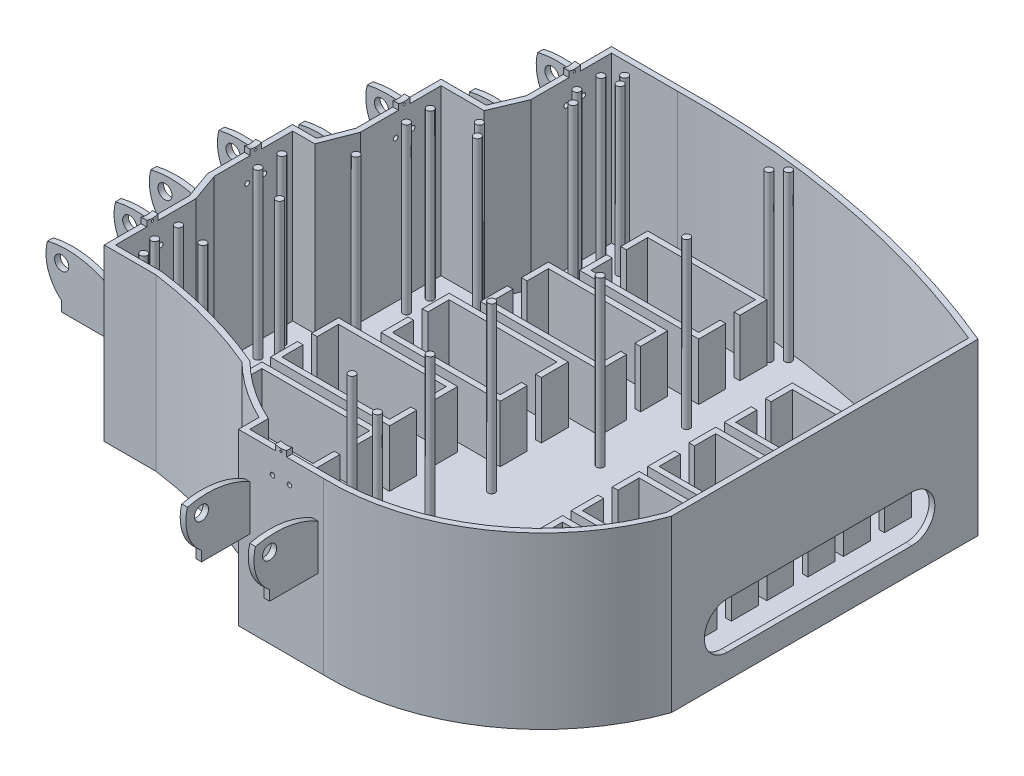
from build123d import *

# Parameters (mm, degrees)
BOSS_EXTRUDE1_DEPTH                = 38.1
CUT_EXTRUDE1_DEPTH                 = 36.83
BOSS_EXTRUDE2_DEPTH                = 13.97
BOSS_EXTRUDE3_DEPTH                = 13.97
BOSS_EXTRUDE4_DEPTH                = 13.97
BOSS_EXTRUDE5_DEPTH                = 13.97
BOSS_EXTRUDE6_DEPTH                = 13.97
BOSS_EXTRUDE7_DEPTH                = 13.97
BOSS_EXTRUDE8_DEPTH                = 13.97
BOSS_EXTRUDE9_DEPTH                = 13.97
BOSS_EXTRUDE10_DEPTH               = 13.97
BOSS_EXTRUDE11_DEPTH               = 13.97
SKETCH25_R                         = 0.508
THUMB_HOLES_DEPTH                  = 12.7
SKETCH31_R                         = 0.508
INDEX_FINGER_HOLES_DEPTH           = 17.018
SKETCH32_R                         = 0.508
MIDDLE_FINGER_HOLES_DEPTH          = 15.24
SKETCH33_R                         = 0.508
RING_FINGER_HOLES_DEPTH            = 22.86
SKETCH34_R                         = 0.508
PINKY_FINGER_HOLES_DEPTH           = 35.56
SKETCH26_R                         = 0.79375
GUIDE_POLES_DEPTH                  = 36.83
SKETCH35_R                         = 1.5875
PINKY_ATTACHMENT_DEPTH             = 19.05
SKETCH36_R                         = 1.5875
RING_ATTACHMENT_DEPTH              = 19.05
SKETCH37_R                         = 1.5875
MIDDLE_ATTACHMENT_DEPTH            = 19.05
SKETCH38_R                         = 1.5875
POINTER_ATTACHMENT_DEPTH           = 19.05
SKETCH39_R                         = 1.5875
THUMB_ATTACHMENT_DEPTH             = 19.05
ATTACHMENT_TRIM_DEPTH              = 25.4
CORD_HOLE_DEPTH                    = 5.08
SKETCH42_W                         = 1.27
SKETCH42_H                         = 2.54
SKETCH42_W_2                       = 2.54
SKETCH42_H_2                       = 1.27
LINE_CONNECTORS_ON_HAND_EDGE_DEPTH = 1.27
SKETCH43_R                         = 0.254
FINGER_LINE_CONNECTOR_CUT_DEPTH    = 50.8
SKETCH44_R                         = 0.254
THUMB_LINE_CONNECTOR_CUT_DEPTH     = 12.7
PINKY_HOOK_DEPTH                   = 19.05
SKETCH47_W                         = 5.527423295
SKETCH47_H                         = 7.099733724
PINKY_HOOK_CUT_1_DEPTH             = 19.05
SKETCH48_W                         = 6.850791153
SKETCH48_H                         = 6.985
SKETCH48_W_2                       = 7.15145582
PINKY_HOOK_CUT_2_DEPTH             = 10.16


with BuildPart() as part:
    # Sketch2 → Boss-Extrude1 (new body)
    with BuildSketch(Plane(origin=(0, 0, 0), x_dir=(1, 0, 0), z_dir=(0, 1, 0))):
        with BuildLine():
            Line((-20.778406205, 52.758673202), (-36.188953289, 52.758673202))
            Line((-36.188953289, 52.758673202), (-36.188953289, 33.708673202))
            Line((-36.188953289, 33.708673202), (-38.864171838, 27.358673202))
            Line((-38.864171838, 27.358673202), (-48.947687906, 27.358673202))
            Line((-48.947687906, 27.358673202), (-48.947687906, 8.308673202))
            Line((-48.947687906, 8.308673202), (-51.417120413, 1.958673202))
            Line((-51.417120413, 1.958673202), (-56.767557511, 1.958673202))
            Line((-56.767557511, 1.958673202), (-56.767557511, -17.091326798))
            Line((-56.767557511, -17.091326798), (-54.503911047, -23.441326798))
            Line((-54.503911047, -23.441326798), (-54.503911047, -42.491326798))
            Line((-54.503911047, -42.491326798), (-42.959403849, -42.491326798))
            ThreePointArc((-42.959403849, -42.491326798), (-29.448791922, -45.239401215), (-16.422067996, -49.755263412))
            ThreePointArc((-16.422067996, -49.755263412), (-10.441569813, -54.6928899), (-3.738179712, -58.593027718))
            Line((-3.738179712, -58.593027718), (-3.738179712, -63.210333869))
            Line((-3.738179712, -63.210333869), (15.311820288, -63.210333869))
            ThreePointArc((15.311820288, -63.210333869), (43.592945253, -54.934630767), (61.572422141, -31.588374066))
            Line((61.572422141, -31.588374066), (61.572422141, 37.055318004))
            ThreePointArc((61.572422141, 37.055318004), (21.220515188, 49.225595088), (-20.778406205, 52.758673202))
        make_face()
    extrude(amount=BOSS_EXTRUDE1_DEPTH)

    # Sketch3 → Cut-Extrude1 (cut)
    with BuildSketch(Plane(origin=(0, 38.1, 0), x_dir=(1, 0, 0), z_dir=(0, 1, 0))):
        with BuildLine():
            Line((-20.193208334, 51.499667825), (-34.918953289, 51.499667825))
            Line((-34.918953289, 51.499667825), (-34.918953289, 33.452072477))
            Line((-34.918953289, 33.452072477), (-38.021111135, 26.088673202))
            Line((-38.021111135, 26.088673202), (-47.677687906, 26.088673202))
            Line((-47.677687906, 26.088673202), (-47.677687906, 8.070420839))
            Line((-47.677687906, 8.070420839), (-50.548353666, 0.688673202))
            Line((-50.548353666, 0.688673202), (-55.497557511, 0.688673202))
            Line((-55.497557511, 0.688673202), (-55.497557511, -16.871730038))
            Line((-55.497557511, -16.871730038), (-53.233911047, -23.221730038))
            Line((-53.233911047, -23.221730038), (-53.233911047, -41.221326798))
            Line((-53.233911047, -41.221326798), (-42.874353316, -41.221326798))
            ThreePointArc((-42.874353316, -41.221326798), (-29.038510393, -44.035017068), (-15.705342229, -48.67980221))
            ThreePointArc((-15.705342229, -48.67980221), (-9.484723257, -53.810670952), (-2.468179712, -57.784338167))
            Line((-2.468179712, -57.784338167), (-2.468179712, -61.940333869))
            Line((-2.468179712, -61.940333869), (15.331165443, -61.940333869))
            ThreePointArc((15.331165443, -61.940333869), (42.778545869, -53.952784334), (60.302422141, -31.367979704))
            Line((60.302422141, -31.367979704), (60.302422141, 36.20914612))
            ThreePointArc((60.302422141, 36.20914612), (20.842965823, 48.004654395), (-20.193208334, 51.499667825))
        make_face()
    extrude(amount=-CUT_EXTRUDE1_DEPTH, mode=Mode.SUBTRACT)

    # Sketch6 → Boss-Extrude2 (add)
    with BuildSketch(Plane(origin=(0, 0, 0), x_dir=(1, 0, 0), z_dir=(0, 1, 0))):
        Polygon((-38.295888343, -32.597001669), (-37.025888343, -32.597001669), (-37.025888343, -37.359501669), (-12.895888343, -37.359501669), (-12.895888343, -32.597001669), (-11.625888343, -32.597001669), (-11.625888343, -38.629501669), (-38.295888343, -38.629501669), align=None)
        Polygon((-12.895888343, -24.659501669), (-37.025888343, -24.659501669), (-37.025888343, -29.422001669), (-38.295888343, -29.422001669), (-38.295888343, -23.389501669), (-11.625888343, -23.389501669), (-11.625888343, -29.422001669), (-12.895888343, -29.422001669), align=None)
    extrude(amount=BOSS_EXTRUDE2_DEPTH)

    # Sketch7 → Boss-Extrude3 (add)
    with BuildSketch(Plane(origin=(0, 0, 0), x_dir=(1, 0, 0), z_dir=(0, 1, 0))):
        Polygon((-38.295888343, -15.452001669), (-37.025888343, -15.452001669), (-37.025888343, -20.214501669), (-12.895888343, -20.214501669), (-12.895888343, -15.452001669), (-11.625888343, -15.452001669), (-11.625888343, -21.484501669), (-38.295888343, -21.484501669), align=None)
        Polygon((-12.895888343, -7.514501669), (-37.025888343, -7.514501669), (-37.025888343, -12.277001669), (-38.295888343, -12.277001669), (-38.295888343, -6.244501669), (-11.625888343, -6.244501669), (-11.625888343, -12.277001669), (-12.895888343, -12.277001669), align=None)
    extrude(amount=BOSS_EXTRUDE3_DEPTH)

    # Sketch15 → Boss-Extrude4 (add)
    with BuildSketch(Plane.XZ):
        Polygon((-30.675888343, -4.867998331), (-29.405888343, -4.867998331), (-29.405888343, -9.630498331), (-5.275888343, -9.630498331), (-5.275888343, -4.867998331), (-4.005888343, -4.867998331), (-4.005888343, -10.900498331), (-30.675888343, -10.900498331), align=None)
        Polygon((-5.275888343, 3.069501669), (-29.405888343, 3.069501669), (-29.405888343, -1.692998331), (-30.675888343, -1.692998331), (-30.675888343, 4.339501669), (-4.005888343, 4.339501669), (-4.005888343, -1.692998331), (-5.275888343, -1.692998331), align=None)
    extrude(amount=-BOSS_EXTRUDE4_DEPTH)

    # Sketch16 → Boss-Extrude5 (add)
    with BuildSketch(Plane.XZ):
        Polygon((-25.595888343, -22.012998331), (-24.325888343, -22.012998331), (-24.325888343, -26.775498331), (-0.195888343, -26.775498331), (-0.195888343, -22.012998331), (1.074111657, -22.012998331), (1.074111657, -28.045498331), (-25.595888343, -28.045498331), align=None)
        Polygon((-0.195888343, -14.075498331), (-24.325888343, -14.075498331), (-24.325888343, -18.837998331), (-25.595888343, -18.837998331), (-25.595888343, -12.805498331), (1.074111657, -12.805498331), (1.074111657, -18.837998331), (-0.195888343, -18.837998331), align=None)
    extrude(amount=-BOSS_EXTRUDE5_DEPTH)

    # Sketch17 → Boss-Extrude6 (add)
    with BuildSketch(Plane.XZ):
        Polygon((-20.515888343, -39.157998331), (-19.245888343, -39.157998331), (-19.245888343, -43.920498331), (4.884111657, -43.920498331), (4.884111657, -39.157998331), (6.154111657, -39.157998331), (6.154111657, -45.190498331), (-20.515888343, -45.190498331), align=None)
        Polygon((4.884111657, -31.220498331), (-19.245888343, -31.220498331), (-19.245888343, -35.982998331), (-20.515888343, -35.982998331), (-20.515888343, -29.950498331), (6.154111657, -29.950498331), (6.154111657, -35.982998331), (4.884111657, -35.982998331), align=None)
    extrude(amount=-BOSS_EXTRUDE6_DEPTH)

    # Sketch18 → Boss-Extrude7 (add)
    with BuildSketch(Plane.XZ):
        Polygon((14.980982224, 42.694916505), (16.250982224, 42.694916505), (16.250982224, 37.932416505), (40.380982224, 37.932416505), (40.380982224, 42.694916505), (41.650982224, 42.694916505), (41.650982224, 36.662416505), (14.980982224, 36.662416505), align=None)
        Polygon((40.380982224, 50.632416505), (16.250982224, 50.632416505), (16.250982224, 45.869916505), (14.980982224, 45.869916505), (14.980982224, 51.902416505), (41.650982224, 51.902416505), (41.650982224, 45.869916505), (40.380982224, 45.869916505), align=None)
    extrude(amount=-BOSS_EXTRUDE7_DEPTH)

    # Sketch19 → Boss-Extrude8 (add)
    with BuildSketch(Plane.XZ):
        Polygon((25.140982224, 25.549916505), (26.410982224, 25.549916505), (26.410982224, 20.787416505), (50.540982224, 20.787416505), (50.540982224, 25.549916505), (51.810982224, 25.549916505), (51.810982224, 19.517416505), (25.140982224, 19.517416505), align=None)
        Polygon((50.540982224, 33.487416505), (26.410982224, 33.487416505), (26.410982224, 28.724916505), (25.140982224, 28.724916505), (25.140982224, 34.757416505), (51.810982224, 34.757416505), (51.810982224, 28.724916505), (50.540982224, 28.724916505), align=None)
    extrude(amount=-BOSS_EXTRUDE8_DEPTH)

    # Sketch20 → Boss-Extrude9 (add)
    with BuildSketch(Plane.XZ):
        Polygon((25.140982224, 8.404916505), (26.410982224, 8.404916505), (26.410982224, 3.642416505), (50.540982224, 3.642416505), (50.540982224, 8.404916505), (51.810982224, 8.404916505), (51.810982224, 2.372416505), (25.140982224, 2.372416505), align=None)
        Polygon((50.540982224, 16.342416505), (26.410982224, 16.342416505), (26.410982224, 11.579916505), (25.140982224, 11.579916505), (25.140982224, 17.612416505), (51.810982224, 17.612416505), (51.810982224, 11.579916505), (50.540982224, 11.579916505), align=None)
    extrude(amount=-BOSS_EXTRUDE9_DEPTH)

    # Sketch21 → Boss-Extrude10 (add)
    with BuildSketch(Plane.XZ):
        Polygon((25.140982224, -8.740083495), (26.410982224, -8.740083495), (26.410982224, -13.502583495), (50.540982224, -13.502583495), (50.540982224, -8.740083495), (51.810982224, -8.740083495), (51.810982224, -14.772583495), (25.140982224, -14.772583495), align=None)
        Polygon((50.540982224, -0.802583495), (26.410982224, -0.802583495), (26.410982224, -5.565083495), (25.140982224, -5.565083495), (25.140982224, 0.467416505), (51.810982224, 0.467416505), (51.810982224, -5.565083495), (50.540982224, -5.565083495), align=None)
    extrude(amount=-BOSS_EXTRUDE10_DEPTH)

    # Sketch22 → Boss-Extrude11 (add)
    with BuildSketch(Plane.XZ):
        Polygon((25.140982224, -25.885083495), (26.410982224, -25.885083495), (26.410982224, -30.647583495), (50.540982224, -30.647583495), (50.540982224, -25.885083495), (51.810982224, -25.885083495), (51.810982224, -31.917583495), (25.140982224, -31.917583495), align=None)
        Polygon((50.540982224, -17.947583495), (26.410982224, -17.947583495), (26.410982224, -22.710083495), (25.140982224, -22.710083495), (25.140982224, -16.677583495), (51.810982224, -16.677583495), (51.810982224, -22.710083495), (50.540982224, -22.710083495), align=None)
    extrude(amount=-BOSS_EXTRUDE11_DEPTH)

    # Sketch25 → Thumb Holes (cut)
    with BuildSketch(Plane.XY.offset(63.5)):
        with Locations((7.691820288, 33.02)):
            Circle(SKETCH25_R)
        with Locations((3.881820288, 33.02)):
            Circle(SKETCH25_R)
    extrude(amount=-THUMB_HOLES_DEPTH, mode=Mode.SUBTRACT)

    # Sketch31 → Index Finger Holes (cut)
    with BuildSketch(Plane(origin=(-69.85, 0, 0), x_dir=(0, 0, -1), z_dir=(1, 0, 0))):
        with Locations((-31.061326798, 33.02)):
            Circle(SKETCH31_R)
        with Locations((-34.871326798, 33.02)):
            Circle(SKETCH31_R)
    extrude(amount=INDEX_FINGER_HOLES_DEPTH, mode=Mode.SUBTRACT)

    # Sketch32 → Middle Finger Holes (cut)
    with BuildSketch(Plane(origin=(-69.85, 0, 0), x_dir=(0, 0, -1), z_dir=(1, 0, 0))):
        with Locations((-9.471326798, 33.02)):
            Circle(SKETCH32_R)
        with Locations((-5.661326798, 33.02)):
            Circle(SKETCH32_R)
    extrude(amount=MIDDLE_FINGER_HOLES_DEPTH, mode=Mode.SUBTRACT)

    # Sketch33 → Ring Finger Holes (cut)
    with BuildSketch(Plane(origin=(-69.85, 0, 0), x_dir=(0, 0, -1), z_dir=(1, 0, 0))):
        with Locations((15.928673202, 33.02)):
            Circle(SKETCH33_R)
        with Locations((19.738673202, 33.02)):
            Circle(SKETCH33_R)
    extrude(amount=RING_FINGER_HOLES_DEPTH, mode=Mode.SUBTRACT)

    # Sketch34 → Pinky Finger Holes (cut)
    with BuildSketch(Plane(origin=(-69.85, 0, 0), x_dir=(0, 0, -1), z_dir=(1, 0, 0))):
        with Locations((41.328673202, 33.02)):
            Circle(SKETCH34_R)
        with Locations((45.181435651, 33.02)):
            Circle(SKETCH34_R)
    extrude(amount=PINKY_FINGER_HOLES_DEPTH, mode=Mode.SUBTRACT)

    # Sketch26 → Guide Poles (add)
    with BuildSketch(Plane(origin=(0, 38.1, 0), x_dir=(1, 0, 0), z_dir=(0, 1, 0))):
        with Locations((8.453820288, -44.282416505)):
            Circle(SKETCH26_R)
        with Locations((3.119820288, -27.137416505)):
            Circle(SKETCH26_R)
        with Locations((-0.26286752, -9.992416505)):
            Circle(SKETCH26_R)
        with Locations((6.891203923, 7.152583495)):
            Circle(SKETCH26_R)
        with Locations((9.098692406, 24.297583495)):
            Circle(SKETCH26_R)
        with Locations((-1.85036752, -39.675840032)):
            Circle(SKETCH26_R)
        with Locations((7.511192406, 48.675794749)):
            Circle(SKETCH26_R)
        with Locations((5.303703923, 46.519643207)):
            Circle(SKETCH26_R)
        with Locations((-48.471411047, -39.675840032)):
            Circle(SKETCH26_R)
        with Locations((-52.322557511, -10.233326798)):
            Circle(SKETCH26_R)
        with Locations((-52.322557511, -4.899326798)):
            Circle(SKETCH26_R)
        with Locations((-43.893096038, -13.864501669)):
            Circle(SKETCH26_R)
        with Locations((-43.893096038, 3.280498331)):
            Circle(SKETCH26_R)
        with Locations((-33.874140009, 20.425498331)):
            Circle(SKETCH26_R)
        with Locations((-44.502687906, 15.166673202)):
            Circle(SKETCH26_R)
        with Locations((-29.603786365, 37.570498331)):
            Circle(SKETCH26_R)
        with Locations((-36.306573109, 23.2953928)):
            Circle(SKETCH26_R)
        with Locations((-44.502687906, 20.500673202)):
            Circle(SKETCH26_R)
        with Locations((-28.009949736, 46.519643207)):
            Circle(SKETCH26_R)
        with Locations((-29.153323684, 48.675794749)):
            Circle(SKETCH26_R)
        with Locations((-31.743953289, 40.566673202)):
            Circle(SKETCH26_R)
        with Locations((-31.743953289, 45.943435651)):
            Circle(SKETCH26_R)
        with Locations((-50.058911047, -35.633326798)):
            Circle(SKETCH26_R)
        with Locations((-50.058911047, -30.299326798)):
            Circle(SKETCH26_R)
        with Locations((-43.893096038, -31.009501669)):
            Circle(SKETCH26_R)
    extrude(amount=-GUIDE_POLES_DEPTH)

    # Sketch35 → Pinky Attachment (add)
    with BuildSketch(Plane(origin=(0, 0, -52.758673202), x_dir=(-1, 0, 0), z_dir=(0, 0, -1))):
        with BuildLine():
            Line((36.188953289, 19.05), (40.633953289, 19.05))
            Line((40.633953289, 19.05), (46.983953289, 19.05))
            Line((46.983953289, 19.05), (46.983953289, 21.249207691))
            ThreePointArc((46.983953289, 21.249207691), (50.046648442, 25.776891551), (50.158953289, 31.242))
            ThreePointArc((50.158953289, 31.242), (42.978780551, 31.567812574), (36.188953289, 29.21))
            Line((36.188953289, 29.21), (36.188953289, 19.05))
        make_face()
        with Locations((46.983953289, 28.575)):
            Circle(SKETCH35_R, mode=Mode.SUBTRACT)
    extrude(amount=-PINKY_ATTACHMENT_DEPTH)

    # Sketch36 → Ring Attachment (add)
    with BuildSketch(Plane(origin=(0, 0, -27.358673202), x_dir=(-1, 0, 0), z_dir=(0, 0, -1))):
        with BuildLine():
            Line((48.947687906, 29.21), (48.947687906, 19.05))
            Line((48.947687906, 19.05), (53.392687906, 19.05))
            Line((53.392687906, 19.05), (59.742687906, 19.05))
            Line((59.742687906, 19.05), (59.742687906, 21.249207691))
            ThreePointArc((59.742687906, 21.249207691), (62.80538306, 25.776891551), (62.917687906, 31.242))
            ThreePointArc((62.917687906, 31.242), (55.737515168, 31.567812574), (48.947687906, 29.21))
        make_face()
        with Locations((59.742687906, 28.707395517)):
            Circle(SKETCH36_R, mode=Mode.SUBTRACT)
    extrude(amount=-RING_ATTACHMENT_DEPTH)

    # Sketch37 → Middle Attachment (add)
    with BuildSketch(Plane(origin=(0, 0, -1.958673202), x_dir=(-1, 0, 0), z_dir=(0, 0, -1))):
        with BuildLine():
            Line((56.767557511, 29.21), (56.767557511, 19.05))
            Line((56.767557511, 19.05), (61.212557511, 19.05))
            Line((61.212557511, 19.05), (67.562557511, 19.05))
            Line((67.562557511, 19.05), (67.562557511, 21.249207691))
            ThreePointArc((67.562557511, 21.249207691), (70.625252665, 25.776891551), (70.737557511, 31.242))
            ThreePointArc((70.737557511, 31.242), (63.557384773, 31.567812574), (56.767557511, 29.21))
        make_face()
        with Locations((67.562557511, 28.575)):
            Circle(SKETCH37_R, mode=Mode.SUBTRACT)
    extrude(amount=-MIDDLE_ATTACHMENT_DEPTH)

    # Sketch38 → Pointer Attachment (add)
    with BuildSketch(Plane(origin=(0, 0, 23.441326798), x_dir=(-1, 0, 0), z_dir=(0, 0, -1))):
        with BuildLine():
            Line((54.503911047, 29.21), (54.503911047, 19.05))
            Line((54.503911047, 19.05), (65.298911047, 19.05))
            Line((65.298911047, 19.05), (65.298911047, 21.249207691))
            ThreePointArc((65.298911047, 21.249207691), (68.3616062, 25.776891551), (68.473911047, 31.242))
            ThreePointArc((68.473911047, 31.242), (61.293738309, 31.567812574), (54.503911047, 29.21))
        make_face()
        with Locations((65.298911047, 28.575)):
            Circle(SKETCH38_R, mode=Mode.SUBTRACT)
    extrude(amount=-POINTER_ATTACHMENT_DEPTH)

    # Sketch39 → Thumb Attachment (add)
    with BuildSketch(Plane.ZY.offset(3.738179712)):
        with BuildLine():
            Line((63.210333869, 19.05), (67.655333869, 19.05))
            Line((67.655333869, 19.05), (74.005333869, 19.05))
            Line((74.005333869, 19.05), (74.005333869, 21.249207691))
            ThreePointArc((74.005333869, 21.249207691), (77.068029022, 25.776891551), (77.180333869, 31.242))
            ThreePointArc((77.180333869, 31.242), (70.000161131, 31.567812574), (63.210333869, 29.21))
            Line((63.210333869, 29.21), (63.210333869, 19.05))
        make_face()
        with Locations((74.005333869, 28.575)):
            Circle(SKETCH39_R, mode=Mode.SUBTRACT)
    extrude(amount=-THUMB_ATTACHMENT_DEPTH)

    # Sketch40 → Attachment Trim (cut)
    with BuildSketch(Plane(origin=(0, 38.1, 0), x_dir=(1, 0, 0), z_dir=(0, 1, 0))):
        with BuildLine():
            Line((-1.198179712, -63.210333869), (12.771820288, -63.210333869))
            Line((12.771820288, -63.210333869), (12.771820288, -78.53587148))
            Line((12.771820288, -78.53587148), (14.041820288, -78.53587148))
            Line((14.041820288, -78.53587148), (14.041820288, -63.210333869))
            Line((14.041820288, -63.210333869), (15.311820288, -63.210333869))
            ThreePointArc((15.311820288, -63.210333869), (4.445704746, -84.821396352), (-6.420410797, -63.210333869))
            Line((-6.420410797, -63.210333869), (-2.468179712, -63.210333869))
            Line((-2.468179712, -63.210333869), (-2.468179712, -78.478629921))
            Line((-2.468179712, -78.478629921), (-1.198179712, -78.478629921))
            Line((-1.198179712, -78.478629921), (-1.198179712, -63.210333869))
        make_face()
        with BuildLine():
            Line((-54.503911047, -42.491326798), (-54.503911047, -41.221326798))
            Line((-54.503911047, -41.221326798), (-69.450746427, -41.221326798))
            Line((-69.450746427, -41.221326798), (-69.450746427, -39.951326798))
            Line((-69.450746427, -39.951326798), (-54.503911047, -39.951326798))
            Line((-54.503911047, -39.951326798), (-54.503911047, -25.981326798))
            Line((-54.503911047, -25.981326798), (-69.522821924, -25.981326798))
            Line((-69.522821924, -25.981326798), (-69.522821924, -24.711326798))
            Line((-69.522821924, -24.711326798), (-54.503911047, -24.711326798))
            Line((-54.503911047, -24.711326798), (-54.503911047, -23.441326798))
            ThreePointArc((-54.503911047, -23.441326798), (-74.827366982, -32.966326798), (-54.503911047, -42.491326798))
        make_face()
        with BuildLine():
            Line((-56.767557511, -17.091326798), (-56.767557511, -15.821326798))
            Line((-56.767557511, -15.821326798), (-71.425044096, -15.821326798))
            Line((-71.425044096, -15.821326798), (-71.425044096, -14.551326798))
            Line((-71.425044096, -14.551326798), (-56.767557511, -14.551326798))
            Line((-56.767557511, -14.551326798), (-56.767557511, -0.581326798))
            Line((-56.767557511, -0.581326798), (-71.300395146, -0.581326798))
            Line((-71.300395146, -0.581326798), (-71.300395146, 0.688673202))
            Line((-71.300395146, 0.688673202), (-56.767557511, 0.688673202))
            Line((-56.767557511, 0.688673202), (-56.767557511, 1.958673202))
            ThreePointArc((-56.767557511, 1.958673202), (-78.393851178, -7.566326798), (-56.767557511, -17.091326798))
        make_face()
        with BuildLine():
            Line((-48.947687906, 8.308673202), (-48.947687906, 9.578673202))
            Line((-48.947687906, 9.578673202), (-63.81659846, 9.578673202))
            Line((-63.81659846, 9.578673202), (-63.81659846, 10.848673202))
            Line((-63.81659846, 10.848673202), (-48.947687906, 10.848673202))
            Line((-48.947687906, 10.848673202), (-48.947687906, 24.818673202))
            Line((-48.947687906, 24.818673202), (-63.871264763, 24.818673202))
            Line((-63.871264763, 24.818673202), (-63.871264763, 26.088673202))
            Line((-63.871264763, 26.088673202), (-48.947687906, 26.088673202))
            Line((-48.947687906, 26.088673202), (-48.947687906, 27.358673202))
            ThreePointArc((-48.947687906, 27.358673202), (-69.447688873, 17.833673202), (-48.947687906, 8.308673202))
        make_face()
        with BuildLine():
            Line((-36.188953289, 33.708673202), (-36.188953289, 34.978673202))
            Line((-36.188953289, 34.978673202), (-51.878710413, 34.978673202))
            Line((-51.878710413, 34.978673202), (-51.878710413, 36.248673202))
            Line((-51.878710413, 36.248673202), (-36.188953289, 36.248673202))
            Line((-36.188953289, 36.248673202), (-36.188953289, 50.218673202))
            Line((-36.188953289, 50.218673202), (-51.739164497, 50.218673202))
            Line((-51.739164497, 50.218673202), (-51.739164497, 51.488673202))
            Line((-51.739164497, 51.488673202), (-36.188953289, 51.488673202))
            Line((-36.188953289, 51.488673202), (-36.188953289, 52.758673202))
            ThreePointArc((-36.188953289, 52.758673202), (-55.79651108, 43.233673202), (-36.188953289, 33.708673202))
        make_face()
    extrude(amount=-ATTACHMENT_TRIM_DEPTH, mode=Mode.SUBTRACT)

    # Sketch41 → Cord Hole (cut)
    with BuildSketch(Plane(origin=(62.913848002, 0, 0), x_dir=(0, 0, -1), z_dir=(1, 0, 0))):
        with BuildLine():
            Line((-19.01291879, 15.851932983), (22.200875308, 15.851932983))
            ThreePointArc((22.200875308, 15.851932983), (27.393164329, 10.659643963), (22.200875308, 5.467354942))
            Line((22.200875308, 5.467354942), (-19.01291879, 5.467354942))
            ThreePointArc((-19.01291879, 5.467354942), (-24.20520781, 10.659643963), (-19.01291879, 15.851932983))
        make_face()
    extrude(amount=-CORD_HOLE_DEPTH, mode=Mode.SUBTRACT)

    # Sketch42 → Line Connectors on Hand Edge (add)
    with BuildSketch(Plane(origin=(0, 38.1, 0), x_dir=(1, 0, 0), z_dir=(0, 1, 0))):
        with Locations((-35.553953289, 43.233673202)):
            Rectangle(SKETCH42_W, SKETCH42_H)
        with Locations((-48.312687906, 17.833673202)):
            Rectangle(SKETCH42_W, SKETCH42_H)
        with Locations((-56.132557511, -7.566326798)):
            Rectangle(SKETCH42_W, SKETCH42_H)
        with Locations((-53.868911047, -32.966326798)):
            Rectangle(SKETCH42_W, SKETCH42_H)
        with Locations((5.786820288, -62.575333869)):
            Rectangle(SKETCH42_W_2, SKETCH42_H_2)
    extrude(amount=LINE_CONNECTORS_ON_HAND_EDGE_DEPTH)

    # Sketch43 → Finger Line Connector Cut (cut)
    with BuildSketch(Plane(origin=(-69.85, 0, 0), x_dir=(0, 0, -1), z_dir=(1, 0, 0))):
        with Locations((-32.966326798, 38.608)):
            Circle(SKETCH43_R)
        with Locations((-7.566326798, 38.608)):
            Circle(SKETCH43_R)
        with Locations((17.833673202, 38.608)):
            Circle(SKETCH43_R)
        with Locations((43.233673202, 38.608)):
            Circle(SKETCH43_R)
        with BuildLine():
            ThreePointArc((-34.236326798, 39.37), (-32.966326798, 39.152102448), (-31.696326798, 39.37))
            ThreePointArc((-31.696326798, 39.37), (-32.966326798, 39.746489645), (-34.236326798, 39.37))
        make_face()
        with BuildLine():
            ThreePointArc((-8.836326798, 39.37), (-7.566326798, 39.152102448), (-6.296326798, 39.37))
            ThreePointArc((-6.296326798, 39.37), (-7.566326798, 39.786489071), (-8.836326798, 39.37))
        make_face()
        with BuildLine():
            ThreePointArc((16.563673202, 39.37), (17.833673202, 39.152102448), (19.103673202, 39.37))
            ThreePointArc((19.103673202, 39.37), (17.833673202, 39.896051224), (16.563673202, 39.37))
        make_face()
        with BuildLine():
            ThreePointArc((41.963673202, 39.37), (43.233673202, 39.152102448), (44.503673202, 39.37))
            ThreePointArc((44.503673202, 39.37), (43.233673202, 39.679166891), (41.963673202, 39.37))
        make_face()
    extrude(amount=FINGER_LINE_CONNECTOR_CUT_DEPTH, mode=Mode.SUBTRACT)

    # Sketch44 → Thumb Line Connector Cut (cut)
    with BuildSketch(Plane.XY.offset(63.5)):
        with Locations((5.786820288, 38.608)):
            Circle(SKETCH44_R)
        with BuildLine():
            ThreePointArc((7.056820288, 39.37), (5.786820288, 39.152102448), (4.516820288, 39.37))
            ThreePointArc((4.516820288, 39.37), (5.786820288, 39.896051224), (7.056820288, 39.37))
        make_face()
    extrude(amount=-THUMB_LINE_CONNECTOR_CUT_DEPTH, mode=Mode.SUBTRACT)

    # Sketch46 → Pinky Hook (add)
    with BuildSketch(Plane(origin=(0, 0, -52.758673202), x_dir=(-1, 0, 0), z_dir=(0, 0, -1))):
        with BuildLine():
            Line((38.728953289, 9.243604952), (36.188953289, 9.243604952))
            Line((36.188953289, 9.243604952), (36.188953289, 12.183816109))
            ThreePointArc((36.188953289, 12.183816109), (37.228074872, 10.792797771), (38.728953289, 9.919831756))
            ThreePointArc((38.728953289, 9.919831756), (40.011077208, 10.520271405), (40.650106055, 11.783604952))
            ThreePointArc((40.650106055, 11.783604952), (40.045282722, 13.07409489), (38.764186085, 13.69856823))
            ThreePointArc((38.764186085, 13.69856823), (38.378904743, 13.481176717), (38.223605208, 13.066951131))
            ThreePointArc((38.223605208, 13.066951131), (37.883185134, 12.706641867), (37.522875871, 13.047061941))
            ThreePointArc((37.522875871, 13.047061941), (37.861533866, 13.935120258), (38.728953289, 14.323604952))
            ThreePointArc((38.728953289, 14.323604952), (40.525004513, 13.579656176), (41.268953289, 11.783604952))
            ThreePointArc((41.268953289, 11.783604952), (40.525004513, 9.987553727), (38.728953289, 9.243604952))
        make_face()
        with BuildLine():
            Line((38.728953289, 6.621971086), (36.188953289, 6.621971086))
            Line((36.188953289, 6.621971086), (36.188953289, 3.681759929))
            ThreePointArc((36.188953289, 3.681759929), (37.228074872, 5.072778267), (38.728953289, 5.945744282))
            ThreePointArc((38.728953289, 5.945744282), (40.011077208, 5.345304633), (40.650106055, 4.081971086))
            ThreePointArc((40.650106055, 4.081971086), (40.045282722, 2.791481148), (38.764186085, 2.167007809))
            ThreePointArc((38.764186085, 2.167007809), (38.378904743, 2.384399321), (38.223605208, 2.798624908))
            ThreePointArc((38.223605208, 2.798624908), (37.883185134, 3.158934171), (37.522875871, 2.818514097))
            ThreePointArc((37.522875871, 2.818514097), (37.861533866, 1.93045578), (38.728953289, 1.541971086))
            ThreePointArc((38.728953289, 1.541971086), (40.525004513, 2.285919862), (41.268953289, 4.081971086))
            ThreePointArc((41.268953289, 4.081971086), (40.525004513, 5.878022311), (38.728953289, 6.621971086))
        make_face()
    extrude(amount=-PINKY_HOOK_DEPTH)

    # Sketch47 → Pinky Hook Cut 1 (cut)
    with BuildSketch(Plane(origin=(0, 0, -52.758673202), x_dir=(-1, 0, 0), z_dir=(0, 0, -1))):
        with Locations((38.952664936, 12.322077186)):
            Rectangle(SKETCH47_W, SKETCH47_H)
    extrude(amount=-PINKY_HOOK_CUT_1_DEPTH, mode=Mode.SUBTRACT)

    # Sketch48 → Pinky Hook Cut 2 (cut)
    with BuildSketch(Plane(origin=(0, 0, 0), x_dir=(1, 0, 0), z_dir=(0, 1, 0))):
        with Locations((-39.614348866, 49.266173202)):
            Rectangle(SKETCH48_W, SKETCH48_H)
        with Locations((-39.764681199, 37.201173202)):
            Rectangle(SKETCH48_W_2, SKETCH48_H)
    extrude(amount=PINKY_HOOK_CUT_2_DEPTH, mode=Mode.SUBTRACT)


solid = part.part
